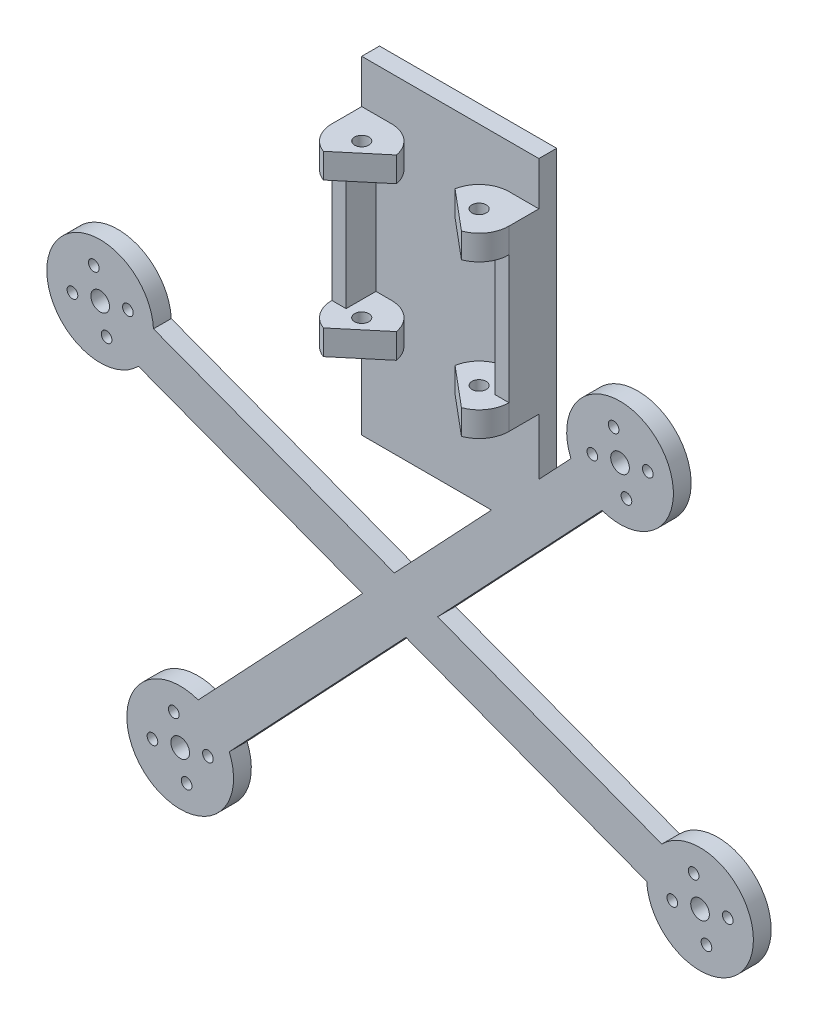
from build123d import *

# Parameters (mm, degrees)
BOSS_EXTRUDE2_DEPTH     = 7
CUT_EXTRUDE2_DEPTH      = 30.130224853
CUT_EXTRUDE2_DEPTH_BACK = 30.130224853
SKETCH3_R               = 2
BOSS_EXTRUDE3_DEPTH     = 36
SKETCH5_R               = 2
BOSS_EXTRUDE4_DEPTH     = 7
SKETCH13_W              = 49.8
SKETCH13_H              = 5
BOSS_EXTRUDE6_DEPTH     = 12.25
SKETCH15_W              = 49.8
SKETCH15_H              = 5
BOSS_EXTRUDE7_DEPTH     = 30
SKETCH12_R              = 1.5
SKETCH12_R_2            = 2.625
BOSS_EXTRUDE8_DEPTH     = 5


with BuildPart() as part:
    # Sketch1 → Boss-Extrude2 (new body)
    with BuildSketch(Plane(origin=(0, 0, 0), x_dir=(1, 0, 0), z_dir=(0, 1, 0))):
        with BuildLine():
            Line((-24.9, 0), (-24.9, 13.4))
            Line((-24.9, 13.4), (24.9, 13.4))
            Line((24.9, 13.4), (24.9, 0))
            ThreePointArc((24.9, 0), (23.392904185, -4.800819919), (19.412411454, -7.878950407))
            Line((19.412411454, -7.878950407), (8.235013612, 1.5))
            ThreePointArc((8.235013612, 1.5), (11.116692467, 6.448255578), (16.5, 8.4))
            Line((16.5, 8.4), (-16.5, 8.4))
            ThreePointArc((-16.5, 8.4), (-11.116692467, 6.448255578), (-8.235013612, 1.5))
            Line((-8.235013612, 1.5), (-19.412411454, -7.878950407))
            ThreePointArc((-19.412411454, -7.878950407), (-23.392904185, -4.800819919), (-24.9, 0))
        make_face()
    extrude(amount=BOSS_EXTRUDE2_DEPTH)

    # Sketch3 → Cut-Extrude2 (cut, two sides: drawn at the far end of the back side and taken through both)
    with BuildSketch(Plane(origin=(0, 7, 0), x_dir=(1, 0, 0), z_dir=(0, 1, 0)).offset(-CUT_EXTRUDE2_DEPTH_BACK)):
        with Locations((-16.5, 0)):
            Circle(SKETCH3_R)
        with Locations((16.5, 0)):
            Circle(SKETCH3_R)
    extrude(amount=CUT_EXTRUDE2_DEPTH + CUT_EXTRUDE2_DEPTH_BACK, mode=Mode.SUBTRACT)

    # Sketch4 → Boss-Extrude3 (add)
    with BuildSketch(Plane(origin=(0, 7, 0), x_dir=(1, 0, 0), z_dir=(0, 1, 0))):
        Polygon((-24.9, 13.4), (-24.9, 0), (-20.9, 0), (-20.9, 8.4), (-16.5, 8.4), (16.5, 8.4), (20.9, 8.4), (20.9, 0), (24.9, 0), (24.9, 13.4), align=None)
    extrude(amount=BOSS_EXTRUDE3_DEPTH)

    # Sketch5 → Boss-Extrude4 (add)
    with BuildSketch(Plane(origin=(0, 43, 0), x_dir=(1, 0, 0), z_dir=(0, 1, 0))):
        with BuildLine():
            Line((-24.9, 13.4), (-24.9, 0))
            ThreePointArc((-24.9, 0), (-23.392904185, -4.800819919), (-19.412411454, -7.878950407))
            Line((-19.412411454, -7.878950407), (-8.235013612, 1.5))
            ThreePointArc((-8.235013612, 1.5), (-11.116692467, 6.448255578), (-16.5, 8.4))
            Line((-16.5, 8.4), (16.5, 8.4))
            ThreePointArc((16.5, 8.4), (11.116692467, 6.448255578), (8.235013612, 1.5))
            Line((8.235013612, 1.5), (19.412411454, -7.878950407))
            ThreePointArc((19.412411454, -7.878950407), (23.392904185, -4.800819919), (24.9, 0))
            Line((24.9, 0), (24.9, 13.4))
            Line((24.9, 13.4), (-24.9, 13.4))
        make_face()
        with Locations((16.5, 0)):
            Circle(SKETCH5_R, mode=Mode.SUBTRACT)
        with Locations((-16.5, 0)):
            Circle(SKETCH5_R, mode=Mode.SUBTRACT)
    extrude(amount=BOSS_EXTRUDE4_DEPTH)

    # Sketch13 → Boss-Extrude6 (add)
    with BuildSketch(Plane(origin=(0, 50, 0), x_dir=(1, 0, 0), z_dir=(0, 1, 0))):
        with Locations((0, 10.9)):
            Rectangle(SKETCH13_W, SKETCH13_H)
    extrude(amount=BOSS_EXTRUDE6_DEPTH)

    # Sketch15 → Boss-Extrude7 (add)
    with BuildSketch(Plane.XZ):
        with Locations((0, -10.9)):
            Rectangle(SKETCH15_W, SKETCH15_H)
    extrude(amount=BOSS_EXTRUDE7_DEPTH)

    # Sketch12 → Boss-Extrude8 (add)
    with BuildSketch(Plane(origin=(0, 0, -13.4), x_dir=(-1, 0, 0), z_dir=(0, 0, -1))):
        with BuildLine():
            Line((3.57214695, -63.566782317), (-59.47254153, -87.376896171))
            ThreePointArc((-59.47254153, -87.376896171), (-84.246316334, -103.146864291), (-55.232789428, -98.602959689))
            Line((-55.232789428, -98.602959689), (12.489425518, -73.02628246))
            Line((12.489425518, -73.02628246), (62.145671786, -125.701912707))
            ThreePointArc((62.145671786, -125.701912707), (86.23094036, -142.504640172), (70.877518071, -117.470578644))
            Line((70.877518071, -117.470578644), (24.650994329, -68.433217683))
            Line((24.650994329, -68.433217683), (87.69568281, -44.623103829))
            ThreePointArc((87.69568281, -44.623103829), (112.469457614, -28.853135709), (83.455930708, -33.397040311))
            Line((83.455930708, -33.397040311), (15.733715762, -58.97371754))
            Line((15.733715762, -58.97371754), (-33.922530506, -6.298087293))
            ThreePointArc((-33.922530506, -6.298087293), (-58.00779908, 10.504640172), (-42.654376791, -14.529421356))
            Line((-42.654376791, -14.529421356), (3.57214695, -63.566782317))
        make_face()
        with Locations((-49.518239937, -8.205128203)):
            Circle(SKETCH12_R, mode=Mode.SUBTRACT)
        with Locations((-55.51359202, 1.38944075)):
            Circle(SKETCH12_R, mode=Mode.SUBTRACT)
        with Locations((-45.919023067, 7.384792833)):
            Circle(SKETCH12_R, mode=Mode.SUBTRACT)
        with Locations((-39.923670984, -2.20977612)):
            Circle(SKETCH12_R, mode=Mode.SUBTRACT)
        with Locations((-62.418776418, -99.646782598)):
            Circle(SKETCH12_R, mode=Mode.SUBTRACT)
        with Locations((-72.013345371, -105.642134682)):
            Circle(SKETCH12_R, mode=Mode.SUBTRACT)
        with Locations((-68.414128501, -90.052213645)):
            Circle(SKETCH12_R, mode=Mode.SUBTRACT)
        with Locations((-78.008697455, -96.047565729)):
            Circle(SKETCH12_R, mode=Mode.SUBTRACT)
        with Locations((100.236486651, -26.357865318)):
            Circle(SKETCH12_R, mode=Mode.SUBTRACT)
        with Locations((90.641917698, -32.353217402)):
            Circle(SKETCH12_R, mode=Mode.SUBTRACT)
        with Locations((96.637269781, -41.947786355)):
            Circle(SKETCH12_R, mode=Mode.SUBTRACT)
        with Locations((106.231838734, -35.952434271)):
            Circle(SKETCH12_R, mode=Mode.SUBTRACT)
        with Locations((68.146812263, -129.79022388)):
            Circle(SKETCH12_R, mode=Mode.SUBTRACT)
        with Locations((77.741381216, -123.794871797)):
            Circle(SKETCH12_R, mode=Mode.SUBTRACT)
        with Locations((83.7367333, -133.38944075)):
            Circle(SKETCH12_R, mode=Mode.SUBTRACT)
        with Locations((74.142164347, -139.384792833)):
            Circle(SKETCH12_R, mode=Mode.SUBTRACT)
        with Locations((-47.718631502, -0.410167685)):
            Circle(SKETCH12_R_2, mode=Mode.SUBTRACT)
        with Locations((-70.213736936, -97.847174163)):
            Circle(SKETCH12_R_2, mode=Mode.SUBTRACT)
        with Locations((98.436878216, -34.152825837)):
            Circle(SKETCH12_R_2, mode=Mode.SUBTRACT)
        with Locations((75.941772782, -131.589832315)):
            Circle(SKETCH12_R_2, mode=Mode.SUBTRACT)
    extrude(amount=-BOSS_EXTRUDE8_DEPTH)


solid = part.part
